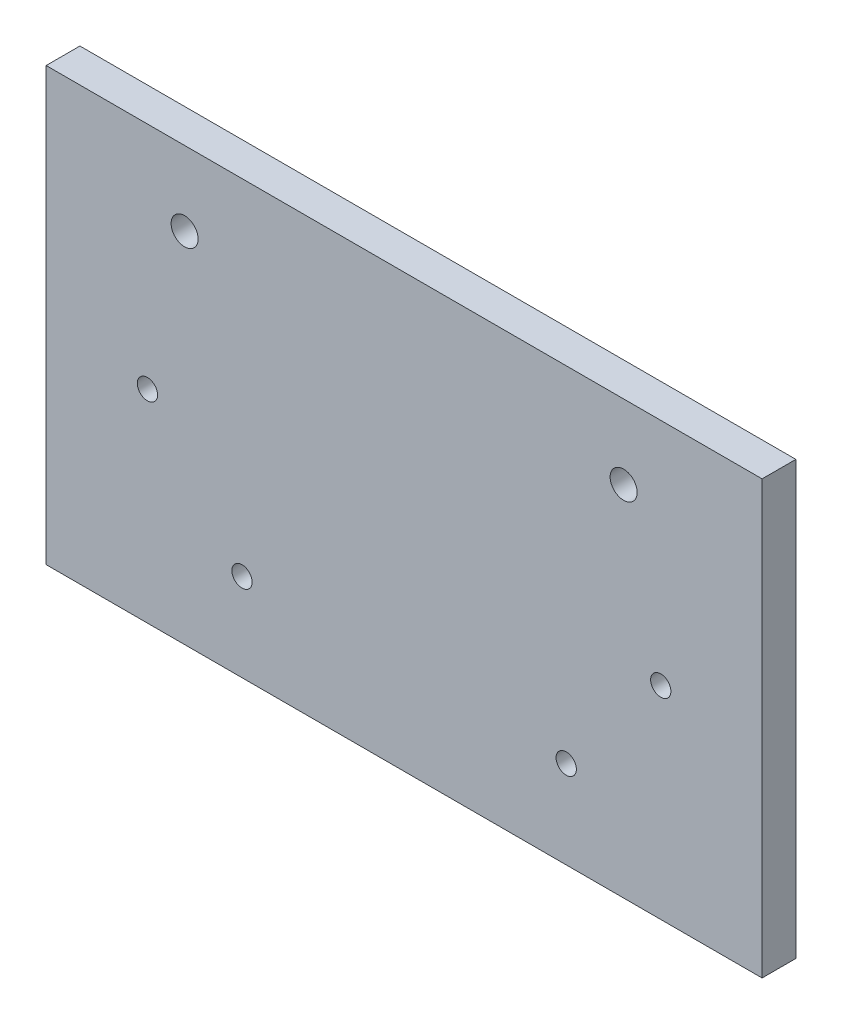
from build123d import *

# Parameters (mm, degrees)
SKETCH1_W           = 106
SKETCH1_H           = 64
BOSS_EXTRUDE1_DEPTH = 5
SKETCH2_R           = 1.5
SKETCH2_R_2         = 2
CUT_EXTRUDE2_DEPTH  = 63.112800613


with BuildPart() as part:
    # Sketch1 → Boss-Extrude1 (new body)
    with BuildSketch(Plane.XY):
        Rectangle(SKETCH1_W, SKETCH1_H)
    extrude(amount=BOSS_EXTRUDE1_DEPTH)

    # Sketch2 → Cut-Extrude2 (cut, through all)
    with BuildSketch(Plane.XY):
        with Locations((-24, -19)):
            Circle(SKETCH2_R)
        with Locations((24, -19)):
            Circle(SKETCH2_R)
        with Locations((-38, -2)):
            Circle(SKETCH2_R)
        with Locations((38, -2)):
            Circle(SKETCH2_R)
        with Locations((-32.5, 21)):
            Circle(SKETCH2_R_2)
        with Locations((32.5, 21)):
            Circle(SKETCH2_R_2)
    extrude(amount=CUT_EXTRUDE2_DEPTH, mode=Mode.SUBTRACT)


solid = part.part
